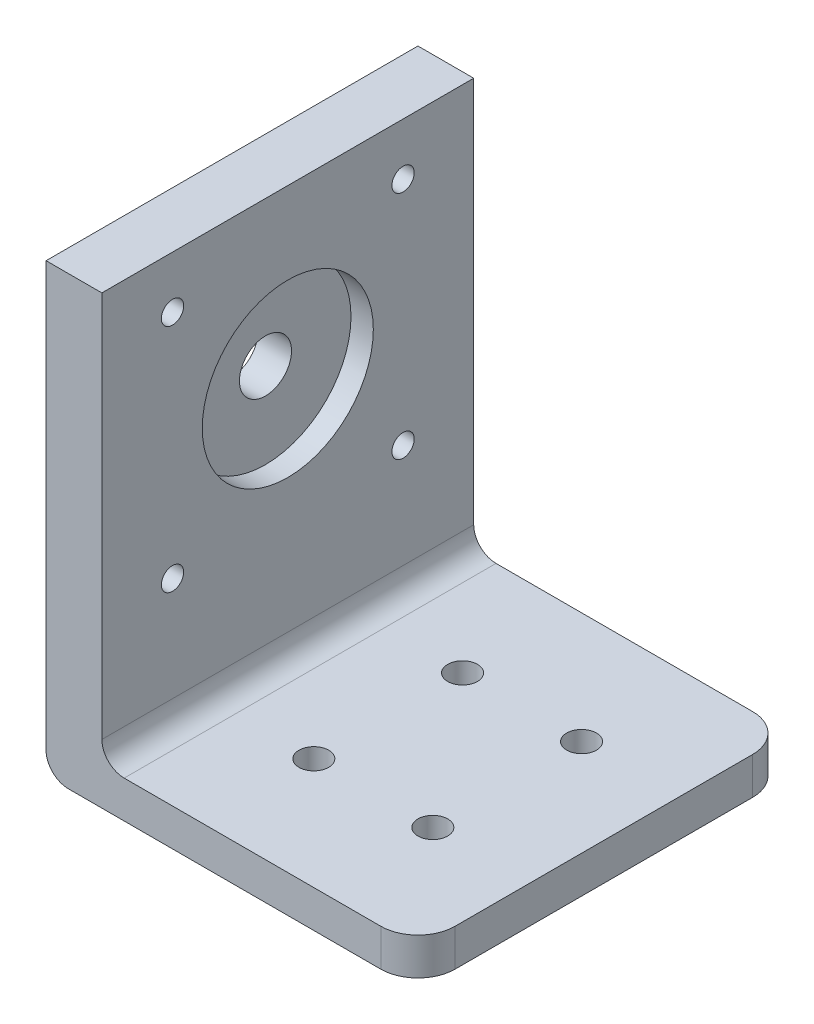
from build123d import *

# Parameters (mm, degrees)
BOSS_EXTRUDE1_DEPTH = 5
SKETCH2_W           = 7.5
SKETCH2_H           = 50
BOSS_EXTRUDE2_DEPTH = 55
FILLET1_R           = 3
FILLET2_R           = 3
SKETCH3_R           = 1.5
SKETCH3_R_2         = 3.5
CUT_EXTRUDE1_DEPTH  = 83.006097334
SKETCH4_R           = 11.5
CUT_EXTRUDE2_DEPTH  = 3
SKETCH6_R           = 2
CUT_EXTRUDE3_DEPTH  = 66.383484153


with BuildPart() as part:
    # Sketch1 → Boss-Extrude1 (new body)
    with BuildSketch(Plane(origin=(0, 0, 0), x_dir=(1, 0, 0), z_dir=(0, 1, 0))):
        with BuildLine():
            Line((-25, 25), (20, 25))
            ThreePointArc((20, 25), (23.535533906, 23.535533906), (25, 20))
            Line((25, 20), (25, -20))
            ThreePointArc((25, -20), (23.535533906, -23.535533906), (20, -25))
            Line((20, -25), (-25, -25))
            Line((-25, -25), (-25, 25))
        make_face()
    extrude(amount=BOSS_EXTRUDE1_DEPTH)

    # Sketch2 → Boss-Extrude2 (add)
    with BuildSketch(Plane(origin=(0, 5, 0), x_dir=(1, 0, 0), z_dir=(0, 1, 0))):
        with Locations((-21.25, 0)):
            Rectangle(SKETCH2_W, SKETCH2_H)
    extrude(amount=BOSS_EXTRUDE2_DEPTH)

    # Fillet1
    fillet1_edges = [part.edges().sort_by_distance(p)[0] for p in [
        (-17.5, 5, 0),
    ]]
    fillet(fillet1_edges, radius=FILLET1_R)

    # Fillet2
    fillet2_edges = [part.edges().sort_by_distance(p)[0] for p in [
        (-25, 0, 0),
    ]]
    fillet(fillet2_edges, radius=FILLET2_R)

    # Sketch3 → Cut-Extrude1 (cut, through all)
    with BuildSketch(Plane.ZY.offset(25)):
        with Locations((15.5, 53)):
            Circle(SKETCH3_R)
        with Locations((-15.5, 53)):
            Circle(SKETCH3_R)
        with Locations((0, 37.5)):
            Circle(SKETCH3_R_2)
        with Locations((15.5, 22)):
            Circle(SKETCH3_R)
        with Locations((-15.5, 22)):
            Circle(SKETCH3_R)
    extrude(amount=-CUT_EXTRUDE1_DEPTH, mode=Mode.SUBTRACT)

    # Sketch4 → Cut-Extrude2 (cut)
    with BuildSketch(Plane(origin=(-17.5, 0, 0), x_dir=(0, 0, -1), z_dir=(1, 0, 0))):
        with Locations((0, 37.5)):
            Circle(SKETCH4_R)
    extrude(amount=-CUT_EXTRUDE2_DEPTH, mode=Mode.SUBTRACT)

    # Sketch6 → Cut-Extrude3 (cut, through all)
    with BuildSketch(Plane(origin=(0, 5, 0), x_dir=(1, 0, 0), z_dir=(0, 1, 0))):
        with Locations((12, -10)):
            Circle(SKETCH6_R)
        with Locations((-4, -10)):
            Circle(SKETCH6_R)
        with Locations((12, 10)):
            Circle(SKETCH6_R)
        with Locations((-4, 10)):
            Circle(SKETCH6_R)
    extrude(amount=-CUT_EXTRUDE3_DEPTH, mode=Mode.SUBTRACT)


solid = part.part
